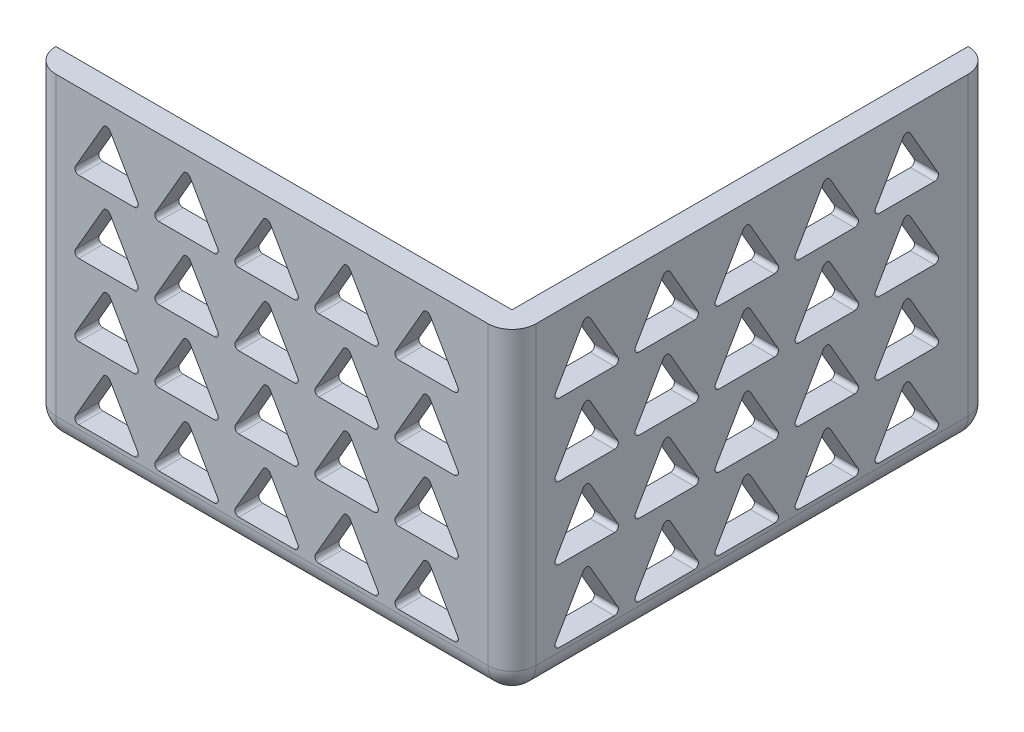
from build123d import *

# Parameters (mm, degrees)
SKETCH4_W           = 152.4
SKETCH4_H           = 101.6
BOSS_EXTRUDE3_DEPTH = 152.4
SKETCH5_W           = 144.78
SKETCH5_H           = 144.78
CUT_EXTRUDE1_DEPTH  = 152.4
FILLET1_R           = 7.62
FILLET2_R           = 7.62
FILLET3_R           = 7.62
CUT_EXTRUDE2_DEPTH  = 7.62
CUT_EXTRUDE3_DEPTH  = 7.62


with BuildPart() as part:
    # Sketch4 → Boss-Extrude3 (new body)
    with BuildSketch(Plane.XY):
        with Locations((76.2, -50.8)):
            Rectangle(SKETCH4_W, SKETCH4_H)
    extrude(amount=BOSS_EXTRUDE3_DEPTH)

    # Sketch5 → Cut-Extrude1 (cut)
    with BuildSketch(Plane(origin=(0, 0, 0), x_dir=(1, 0, 0), z_dir=(0, 1, 0))):
        with Locations((72.39, -72.39)):
            Rectangle(SKETCH5_W, SKETCH5_H)
    extrude(amount=-CUT_EXTRUDE1_DEPTH, mode=Mode.SUBTRACT)

    # Fillet1
    fillet1_edges = [part.edges().sort_by_distance(p)[0] for p in [
        (152.4, -50.8, 152.4),
    ]]
    fillet(fillet1_edges, radius=FILLET1_R)

    # Fillet2
    fillet2_edges = [part.edges().sort_by_distance(p)[0] for p in [
        (148.59, -101.6, 0),
        (0, -101.6, 148.59),
    ]]
    fillet(fillet2_edges, radius=FILLET2_R)

    # Fillet3
    fillet3_edges = [part.edges().sort_by_distance(p)[0] for p in [
        (0, -46.99, 152.4),
        (2.231846327, -99.368153673, 152.4),
        (152.4, -46.99, 0),
        (152.4, -99.368153673, 2.231846327),
        (152.4, -101.6, 76.2),
        (150.168153673, -101.6, 150.168153673),
        (76.2, -101.6, 152.4),
    ]]
    fillet(fillet3_edges, radius=FILLET3_R - 0.0001)  # a hair under: the kernel refuses the full size

    # Sketch6 → Cut-Extrude2 (cut)
    with BuildSketch(Plane.XY.offset(152.4)):
        with BuildLine():
            Line((22.598670365, -6.985), (13.799852263, -22.225))
            ThreePointArc((13.799852263, -22.225), (13.799852263, -23.495), (14.899704526, -24.13))
            Line((14.899704526, -24.13), (32.497340731, -24.13))
            ThreePointArc((32.497340731, -24.13), (33.597192993, -23.495), (33.597192993, -22.225))
            Line((33.597192993, -22.225), (24.798374891, -6.985))
            ThreePointArc((24.798374891, -6.985), (23.698522628, -6.35), (22.598670365, -6.985))
        make_face()
        with BuildLine():
            Line((58.997192993, -22.225), (50.198374891, -6.985))
            ThreePointArc((50.198374891, -6.985), (49.098522628, -6.35), (47.998670365, -6.985))
            Line((47.998670365, -6.985), (39.199852263, -22.225))
            ThreePointArc((39.199852263, -22.225), (39.199852263, -23.495), (40.299704526, -24.13))
            Line((40.299704526, -24.13), (57.897340731, -24.13))
            ThreePointArc((57.897340731, -24.13), (58.997192993, -23.495), (58.997192993, -22.225))
        make_face()
        with BuildLine():
            Line((84.397192993, -22.225), (75.598374891, -6.985))
            ThreePointArc((75.598374891, -6.985), (74.498522628, -6.35), (73.398670365, -6.985))
            Line((73.398670365, -6.985), (64.599852263, -22.225))
            ThreePointArc((64.599852263, -22.225), (64.599852263, -23.495), (65.699704526, -24.13))
            Line((65.699704526, -24.13), (83.297340731, -24.13))
            ThreePointArc((83.297340731, -24.13), (84.397192993, -23.495), (84.397192993, -22.225))
        make_face()
        with BuildLine():
            Line((109.797192993, -22.225), (100.998374891, -6.985))
            ThreePointArc((100.998374891, -6.985), (99.898522628, -6.35), (98.798670365, -6.985))
            Line((98.798670365, -6.985), (89.999852263, -22.225))
            ThreePointArc((89.999852263, -22.225), (89.999852263, -23.495), (91.099704526, -24.13))
            Line((91.099704526, -24.13), (108.697340731, -24.13))
            ThreePointArc((108.697340731, -24.13), (109.797192993, -23.495), (109.797192993, -22.225))
        make_face()
        with BuildLine():
            Line((135.197192993, -22.225), (126.398374891, -6.985))
            ThreePointArc((126.398374891, -6.985), (125.298522628, -6.35), (124.198670365, -6.985))
            Line((124.198670365, -6.985), (115.399852263, -22.225))
            ThreePointArc((115.399852263, -22.225), (115.399852263, -23.495), (116.499704526, -24.13))
            Line((116.499704526, -24.13), (134.097340731, -24.13))
            ThreePointArc((134.097340731, -24.13), (135.197192993, -23.495), (135.197192993, -22.225))
        make_face()
        with BuildLine():
            Line((22.598670365, -29.845), (13.799852263, -45.085))
            ThreePointArc((13.799852263, -45.085), (13.799852263, -46.355), (14.899704526, -46.99))
            Line((14.899704526, -46.99), (32.497340731, -46.99))
            ThreePointArc((32.497340731, -46.99), (33.597192993, -46.355), (33.597192993, -45.085))
            Line((33.597192993, -45.085), (24.798374891, -29.845))
            ThreePointArc((24.798374891, -29.845), (23.698522628, -29.21), (22.598670365, -29.845))
        make_face()
        with BuildLine():
            Line((47.998670365, -29.845), (39.199852263, -45.085))
            ThreePointArc((39.199852263, -45.085), (39.199852263, -46.355), (40.299704526, -46.99))
            Line((40.299704526, -46.99), (57.897340731, -46.99))
            ThreePointArc((57.897340731, -46.99), (58.997192993, -46.355), (58.997192993, -45.085))
            Line((58.997192993, -45.085), (50.198374891, -29.845))
            ThreePointArc((50.198374891, -29.845), (49.098522628, -29.21), (47.998670365, -29.845))
        make_face()
        with BuildLine():
            Line((65.699704526, -46.99), (83.297340731, -46.99))
            ThreePointArc((83.297340731, -46.99), (84.397192993, -46.355), (84.397192993, -45.085))
            Line((84.397192993, -45.085), (75.598374891, -29.845))
            ThreePointArc((75.598374891, -29.845), (74.498522628, -29.21), (73.398670365, -29.845))
            Line((73.398670365, -29.845), (64.599852263, -45.085))
            ThreePointArc((64.599852263, -45.085), (64.599852263, -46.355), (65.699704526, -46.99))
        make_face()
        with BuildLine():
            Line((98.798670365, -29.845), (89.999852263, -45.085))
            ThreePointArc((89.999852263, -45.085), (89.999852263, -46.355), (91.099704526, -46.99))
            Line((91.099704526, -46.99), (108.697340731, -46.99))
            ThreePointArc((108.697340731, -46.99), (109.797192993, -46.355), (109.797192993, -45.085))
            Line((109.797192993, -45.085), (100.998374891, -29.845))
            ThreePointArc((100.998374891, -29.845), (99.898522628, -29.21), (98.798670365, -29.845))
        make_face()
        with BuildLine():
            Line((124.198670365, -29.845), (115.399852263, -45.085))
            ThreePointArc((115.399852263, -45.085), (115.399852263, -46.355), (116.499704526, -46.99))
            Line((116.499704526, -46.99), (134.097340731, -46.99))
            ThreePointArc((134.097340731, -46.99), (135.197192993, -46.355), (135.197192993, -45.085))
            Line((135.197192993, -45.085), (126.398374891, -29.845))
            ThreePointArc((126.398374891, -29.845), (125.298522628, -29.21), (124.198670365, -29.845))
        make_face()
        with BuildLine():
            Line((22.598670365, -52.705), (13.799852263, -67.945))
            ThreePointArc((13.799852263, -67.945), (13.799852263, -69.215), (14.899704526, -69.85))
            Line((14.899704526, -69.85), (32.497340731, -69.85))
            ThreePointArc((32.497340731, -69.85), (33.597192993, -69.215), (33.597192993, -67.945))
            Line((33.597192993, -67.945), (24.798374891, -52.705))
            ThreePointArc((24.798374891, -52.705), (23.698522628, -52.07), (22.598670365, -52.705))
        make_face()
        with BuildLine():
            Line((47.998670365, -52.705), (39.199852263, -67.945))
            ThreePointArc((39.199852263, -67.945), (39.199852263, -69.215), (40.299704526, -69.85))
            Line((40.299704526, -69.85), (57.897340731, -69.85))
            ThreePointArc((57.897340731, -69.85), (58.997192993, -69.215), (58.997192993, -67.945))
            Line((58.997192993, -67.945), (50.198374891, -52.705))
            ThreePointArc((50.198374891, -52.705), (49.098522628, -52.07), (47.998670365, -52.705))
        make_face()
        with BuildLine():
            Line((65.699704526, -69.85), (83.297340731, -69.85))
            ThreePointArc((83.297340731, -69.85), (84.397192993, -69.215), (84.397192993, -67.945))
            Line((84.397192993, -67.945), (75.598374891, -52.705))
            ThreePointArc((75.598374891, -52.705), (74.498522628, -52.07), (73.398670365, -52.705))
            Line((73.398670365, -52.705), (64.599852263, -67.945))
            ThreePointArc((64.599852263, -67.945), (64.599852263, -69.215), (65.699704526, -69.85))
        make_face()
        with BuildLine():
            Line((98.798670365, -52.705), (89.999852263, -67.945))
            ThreePointArc((89.999852263, -67.945), (89.999852263, -69.215), (91.099704526, -69.85))
            Line((91.099704526, -69.85), (108.697340731, -69.85))
            ThreePointArc((108.697340731, -69.85), (109.797192993, -69.215), (109.797192993, -67.945))
            Line((109.797192993, -67.945), (100.998374891, -52.705))
            ThreePointArc((100.998374891, -52.705), (99.898522628, -52.07), (98.798670365, -52.705))
        make_face()
        with BuildLine():
            Line((124.198670365, -52.705), (115.399852263, -67.945))
            ThreePointArc((115.399852263, -67.945), (115.399852263, -69.215), (116.499704526, -69.85))
            Line((116.499704526, -69.85), (134.097340731, -69.85))
            ThreePointArc((134.097340731, -69.85), (135.197192993, -69.215), (135.197192993, -67.945))
            Line((135.197192993, -67.945), (126.398374891, -52.705))
            ThreePointArc((126.398374891, -52.705), (125.298522628, -52.07), (124.198670365, -52.705))
        make_face()
        with BuildLine():
            Line((22.598670365, -75.565), (13.799852263, -90.805))
            ThreePointArc((13.799852263, -90.805), (13.799852263, -92.075), (14.899704526, -92.71))
            Line((14.899704526, -92.71), (32.497340731, -92.71))
            ThreePointArc((32.497340731, -92.71), (33.597192993, -92.075), (33.597192993, -90.805))
            Line((33.597192993, -90.805), (24.798374891, -75.565))
            ThreePointArc((24.798374891, -75.565), (23.698522628, -74.93), (22.598670365, -75.565))
        make_face()
        with BuildLine():
            Line((47.998670365, -75.565), (39.199852263, -90.805))
            ThreePointArc((39.199852263, -90.805), (39.199852263, -92.075), (40.299704526, -92.71))
            Line((40.299704526, -92.71), (57.897340731, -92.71))
            ThreePointArc((57.897340731, -92.71), (58.997192993, -92.075), (58.997192993, -90.805))
            Line((58.997192993, -90.805), (50.198374891, -75.565))
            ThreePointArc((50.198374891, -75.565), (49.098522628, -74.93), (47.998670365, -75.565))
        make_face()
        with BuildLine():
            Line((65.699704526, -92.71), (83.297340731, -92.71))
            ThreePointArc((83.297340731, -92.71), (84.397192993, -92.075), (84.397192993, -90.805))
            Line((84.397192993, -90.805), (75.598374891, -75.565))
            ThreePointArc((75.598374891, -75.565), (74.498522628, -74.93), (73.398670365, -75.565))
            Line((73.398670365, -75.565), (64.599852263, -90.805))
            ThreePointArc((64.599852263, -90.805), (64.599852263, -92.075), (65.699704526, -92.71))
        make_face()
        with BuildLine():
            Line((98.798670365, -75.565), (89.999852263, -90.805))
            ThreePointArc((89.999852263, -90.805), (89.999852263, -92.075), (91.099704526, -92.71))
            Line((91.099704526, -92.71), (108.697340731, -92.71))
            ThreePointArc((108.697340731, -92.71), (109.797192993, -92.075), (109.797192993, -90.805))
            Line((109.797192993, -90.805), (100.998374891, -75.565))
            ThreePointArc((100.998374891, -75.565), (99.898522628, -74.93), (98.798670365, -75.565))
        make_face()
        with BuildLine():
            Line((124.198670365, -75.565), (115.399852263, -90.805))
            ThreePointArc((115.399852263, -90.805), (115.399852263, -92.075), (116.499704526, -92.71))
            Line((116.499704526, -92.71), (134.097340731, -92.71))
            ThreePointArc((134.097340731, -92.71), (135.197192993, -92.075), (135.197192993, -90.805))
            Line((135.197192993, -90.805), (126.398374891, -75.565))
            ThreePointArc((126.398374891, -75.565), (125.298522628, -74.93), (124.198670365, -75.565))
        make_face()
    extrude(amount=-CUT_EXTRUDE2_DEPTH, mode=Mode.SUBTRACT)

    # Sketch7 → Cut-Extrude3 (cut)
    with BuildSketch(Plane(origin=(152.4, 0, 0), x_dir=(0, 0, -1), z_dir=(1, 0, 0))):
        with BuildLine():
            Line((-129.801329635, -6.985), (-138.600147737, -22.225))
            ThreePointArc((-138.600147737, -22.225), (-138.600147737, -23.495), (-137.500295474, -24.13))
            Line((-137.500295474, -24.13), (-119.902659269, -24.13))
            ThreePointArc((-119.902659269, -24.13), (-118.802807007, -23.495), (-118.802807007, -22.225))
            Line((-118.802807007, -22.225), (-127.601625109, -6.985))
            ThreePointArc((-127.601625109, -6.985), (-128.701477372, -6.35), (-129.801329635, -6.985))
        make_face()
        with BuildLine():
            Line((-112.100295474, -24.13), (-94.502659269, -24.13))
            ThreePointArc((-94.502659269, -24.13), (-93.402807007, -23.495), (-93.402807007, -22.225))
            Line((-93.402807007, -22.225), (-102.201625109, -6.985))
            ThreePointArc((-102.201625109, -6.985), (-103.301477372, -6.35), (-104.401329635, -6.985))
            Line((-104.401329635, -6.985), (-113.200147737, -22.225))
            ThreePointArc((-113.200147737, -22.225), (-113.200147737, -23.495), (-112.100295474, -24.13))
        make_face()
        with BuildLine():
            Line((-86.700295474, -24.13), (-69.102659269, -24.13))
            ThreePointArc((-69.102659269, -24.13), (-68.002807007, -23.495), (-68.002807007, -22.225))
            Line((-68.002807007, -22.225), (-76.801625109, -6.985))
            ThreePointArc((-76.801625109, -6.985), (-77.901477372, -6.35), (-79.001329635, -6.985))
            Line((-79.001329635, -6.985), (-87.800147737, -22.225))
            ThreePointArc((-87.800147737, -22.225), (-87.800147737, -23.495), (-86.700295474, -24.13))
        make_face()
        with BuildLine():
            Line((-61.300295474, -24.13), (-43.702659269, -24.13))
            ThreePointArc((-43.702659269, -24.13), (-42.602807007, -23.495), (-42.602807007, -22.225))
            Line((-42.602807007, -22.225), (-51.401625109, -6.985))
            ThreePointArc((-51.401625109, -6.985), (-52.501477372, -6.35), (-53.601329635, -6.985))
            Line((-53.601329635, -6.985), (-62.400147737, -22.225))
            ThreePointArc((-62.400147737, -22.225), (-62.400147737, -23.495), (-61.300295474, -24.13))
        make_face()
        with BuildLine():
            Line((-35.900295474, -24.13), (-18.302659269, -24.13))
            ThreePointArc((-18.302659269, -24.13), (-17.202807007, -23.495), (-17.202807007, -22.225))
            Line((-17.202807007, -22.225), (-26.001625109, -6.985))
            ThreePointArc((-26.001625109, -6.985), (-27.101477372, -6.35), (-28.201329635, -6.985))
            Line((-28.201329635, -6.985), (-37.000147737, -22.225))
            ThreePointArc((-37.000147737, -22.225), (-37.000147737, -23.495), (-35.900295474, -24.13))
        make_face()
        with BuildLine():
            Line((-35.900295474, -46.99), (-18.302659269, -46.99))
            ThreePointArc((-18.302659269, -46.99), (-17.202807007, -46.355), (-17.202807007, -45.085))
            Line((-17.202807007, -45.085), (-26.001625109, -29.845))
            ThreePointArc((-26.001625109, -29.845), (-27.101477372, -29.21), (-28.201329635, -29.845))
            Line((-28.201329635, -29.845), (-37.000147737, -45.085))
            ThreePointArc((-37.000147737, -45.085), (-37.000147737, -46.355), (-35.900295474, -46.99))
        make_face()
        with BuildLine():
            Line((-61.300295474, -46.99), (-43.702659269, -46.99))
            ThreePointArc((-43.702659269, -46.99), (-42.602807007, -46.355), (-42.602807007, -45.085))
            Line((-42.602807007, -45.085), (-51.401625109, -29.845))
            ThreePointArc((-51.401625109, -29.845), (-52.501477372, -29.21), (-53.601329635, -29.845))
            Line((-53.601329635, -29.845), (-62.400147737, -45.085))
            ThreePointArc((-62.400147737, -45.085), (-62.400147737, -46.355), (-61.300295474, -46.99))
        make_face()
        with BuildLine():
            Line((-86.700295474, -46.99), (-69.102659269, -46.99))
            ThreePointArc((-69.102659269, -46.99), (-68.002807007, -46.355), (-68.002807007, -45.085))
            Line((-68.002807007, -45.085), (-76.801625109, -29.845))
            ThreePointArc((-76.801625109, -29.845), (-77.901477372, -29.21), (-79.001329635, -29.845))
            Line((-79.001329635, -29.845), (-87.800147737, -45.085))
            ThreePointArc((-87.800147737, -45.085), (-87.800147737, -46.355), (-86.700295474, -46.99))
        make_face()
        with BuildLine():
            Line((-112.100295474, -46.99), (-94.502659269, -46.99))
            ThreePointArc((-94.502659269, -46.99), (-93.402807007, -46.355), (-93.402807007, -45.085))
            Line((-93.402807007, -45.085), (-102.201625109, -29.845))
            ThreePointArc((-102.201625109, -29.845), (-103.301477372, -29.21), (-104.401329635, -29.845))
            Line((-104.401329635, -29.845), (-113.200147737, -45.085))
            ThreePointArc((-113.200147737, -45.085), (-113.200147737, -46.355), (-112.100295474, -46.99))
        make_face()
        with BuildLine():
            Line((-137.500295474, -46.99), (-119.902659269, -46.99))
            ThreePointArc((-119.902659269, -46.99), (-118.802807007, -46.355), (-118.802807007, -45.085))
            Line((-118.802807007, -45.085), (-127.601625109, -29.845))
            ThreePointArc((-127.601625109, -29.845), (-128.701477372, -29.21), (-129.801329635, -29.845))
            Line((-129.801329635, -29.845), (-138.600147737, -45.085))
            ThreePointArc((-138.600147737, -45.085), (-138.600147737, -46.355), (-137.500295474, -46.99))
        make_face()
        with BuildLine():
            Line((-35.900295474, -69.85), (-18.302659269, -69.85))
            ThreePointArc((-18.302659269, -69.85), (-17.202807007, -69.215), (-17.202807007, -67.945))
            Line((-17.202807007, -67.945), (-26.001625109, -52.705))
            ThreePointArc((-26.001625109, -52.705), (-27.101477372, -52.07), (-28.201329635, -52.705))
            Line((-28.201329635, -52.705), (-37.000147737, -67.945))
            ThreePointArc((-37.000147737, -67.945), (-37.000147737, -69.215), (-35.900295474, -69.85))
        make_face()
        with BuildLine():
            Line((-61.300295474, -69.85), (-43.702659269, -69.85))
            ThreePointArc((-43.702659269, -69.85), (-42.602807007, -69.215), (-42.602807007, -67.945))
            Line((-42.602807007, -67.945), (-51.401625109, -52.705))
            ThreePointArc((-51.401625109, -52.705), (-52.501477372, -52.07), (-53.601329635, -52.705))
            Line((-53.601329635, -52.705), (-62.400147737, -67.945))
            ThreePointArc((-62.400147737, -67.945), (-62.400147737, -69.215), (-61.300295474, -69.85))
        make_face()
        with BuildLine():
            Line((-86.700295474, -69.85), (-69.102659269, -69.85))
            ThreePointArc((-69.102659269, -69.85), (-68.002807007, -69.215), (-68.002807007, -67.945))
            Line((-68.002807007, -67.945), (-76.801625109, -52.705))
            ThreePointArc((-76.801625109, -52.705), (-77.901477372, -52.07), (-79.001329635, -52.705))
            Line((-79.001329635, -52.705), (-87.800147737, -67.945))
            ThreePointArc((-87.800147737, -67.945), (-87.800147737, -69.215), (-86.700295474, -69.85))
        make_face()
        with BuildLine():
            Line((-112.100295474, -69.85), (-94.502659269, -69.85))
            ThreePointArc((-94.502659269, -69.85), (-93.402807007, -69.215), (-93.402807007, -67.945))
            Line((-93.402807007, -67.945), (-102.201625109, -52.705))
            ThreePointArc((-102.201625109, -52.705), (-103.301477372, -52.07), (-104.401329635, -52.705))
            Line((-104.401329635, -52.705), (-113.200147737, -67.945))
            ThreePointArc((-113.200147737, -67.945), (-113.200147737, -69.215), (-112.100295474, -69.85))
        make_face()
        with BuildLine():
            Line((-137.500295474, -69.85), (-119.902659269, -69.85))
            ThreePointArc((-119.902659269, -69.85), (-118.802807007, -69.215), (-118.802807007, -67.945))
            Line((-118.802807007, -67.945), (-127.601625109, -52.705))
            ThreePointArc((-127.601625109, -52.705), (-128.701477372, -52.07), (-129.801329635, -52.705))
            Line((-129.801329635, -52.705), (-138.600147737, -67.945))
            ThreePointArc((-138.600147737, -67.945), (-138.600147737, -69.215), (-137.500295474, -69.85))
        make_face()
        with BuildLine():
            Line((-35.900295474, -92.71), (-18.302659269, -92.71))
            ThreePointArc((-18.302659269, -92.71), (-17.202807007, -92.075), (-17.202807007, -90.805))
            Line((-17.202807007, -90.805), (-26.001625109, -75.565))
            ThreePointArc((-26.001625109, -75.565), (-27.101477372, -74.93), (-28.201329635, -75.565))
            Line((-28.201329635, -75.565), (-37.000147737, -90.805))
            ThreePointArc((-37.000147737, -90.805), (-37.000147737, -92.075), (-35.900295474, -92.71))
        make_face()
        with BuildLine():
            Line((-61.300295474, -92.71), (-43.702659269, -92.71))
            ThreePointArc((-43.702659269, -92.71), (-42.602807007, -92.075), (-42.602807007, -90.805))
            Line((-42.602807007, -90.805), (-51.401625109, -75.565))
            ThreePointArc((-51.401625109, -75.565), (-52.501477372, -74.93), (-53.601329635, -75.565))
            Line((-53.601329635, -75.565), (-62.400147737, -90.805))
            ThreePointArc((-62.400147737, -90.805), (-62.400147737, -92.075), (-61.300295474, -92.71))
        make_face()
        with BuildLine():
            Line((-86.700295474, -92.71), (-69.102659269, -92.71))
            ThreePointArc((-69.102659269, -92.71), (-68.002807007, -92.075), (-68.002807007, -90.805))
            Line((-68.002807007, -90.805), (-76.801625109, -75.565))
            ThreePointArc((-76.801625109, -75.565), (-77.901477372, -74.93), (-79.001329635, -75.565))
            Line((-79.001329635, -75.565), (-87.800147737, -90.805))
            ThreePointArc((-87.800147737, -90.805), (-87.800147737, -92.075), (-86.700295474, -92.71))
        make_face()
        with BuildLine():
            Line((-112.100295474, -92.71), (-94.502659269, -92.71))
            ThreePointArc((-94.502659269, -92.71), (-93.402807007, -92.075), (-93.402807007, -90.805))
            Line((-93.402807007, -90.805), (-102.201625109, -75.565))
            ThreePointArc((-102.201625109, -75.565), (-103.301477372, -74.93), (-104.401329635, -75.565))
            Line((-104.401329635, -75.565), (-113.200147737, -90.805))
            ThreePointArc((-113.200147737, -90.805), (-113.200147737, -92.075), (-112.100295474, -92.71))
        make_face()
        with BuildLine():
            Line((-137.500295474, -92.71), (-119.902659269, -92.71))
            ThreePointArc((-119.902659269, -92.71), (-118.802807007, -92.075), (-118.802807007, -90.805))
            Line((-118.802807007, -90.805), (-127.601625109, -75.565))
            ThreePointArc((-127.601625109, -75.565), (-128.701477372, -74.93), (-129.801329635, -75.565))
            Line((-129.801329635, -75.565), (-138.600147737, -90.805))
            ThreePointArc((-138.600147737, -90.805), (-138.600147737, -92.075), (-137.500295474, -92.71))
        make_face()
    extrude(amount=-CUT_EXTRUDE3_DEPTH, mode=Mode.SUBTRACT)


solid = part.part
